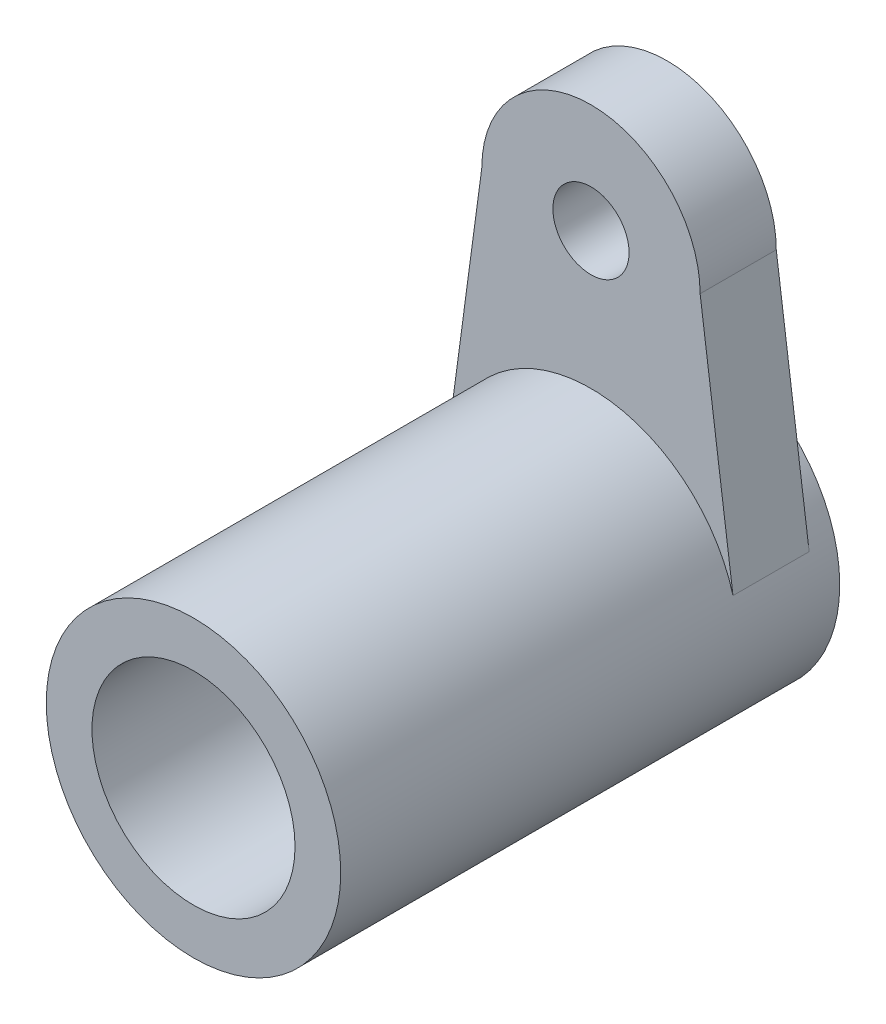
from build123d import *

# Parameters (mm, degrees)
EXTRUDE_1_DEPTH     = 1.5
SKETCH_3_R          = 2.9
EXTRUDE_2_DEPTH     = 3.829
EXTRUDE_START       = 0.5
SKETCH_4_R          = 2.9
EXTRUDE_3_DEPTH     = 0.5
SKETCH_5_R          = 2
CUT_EXTRUDE_1_DEPTH = 3
CUT_EXTRUDE_START   = -0.7
SKETCH_6_R          = 2
CUT_EXTRUDE_2_DEPTH = 0.7
SKETCH_7_R          = 1.1
CUT_EXTRUDE_3_DEPTH = 3.7
SKETCH_8_R          = 0.75
CUT_EXTRUDE_4_DEPTH = 3.7
SKETCH_10_R         = 2.9
SKETCH_10_R_2       = 2
EXTRUDE_4_DEPTH     = 4


with BuildPart() as part:
    # 草图1 → 凸台-拉伸1 (new body)
    with BuildSketch(Plane.XY):
        with BuildLine():
            Line((-2.15, 0), (-2.797439847, -4.825584994))
            ThreePointArc((-2.797439847, -4.825584994), (0, -8.49), (2.797439847, -4.825584994))
            Line((2.797439847, -4.825584994), (2.15, 0))
            ThreePointArc((2.15, 0), (0, 2.15), (-2.15, 0))
        make_face()
    extrude(amount=EXTRUDE_1_DEPTH)

    # 草图3 → 凸台-拉伸2 (add)
    with BuildSketch(Plane.XY.offset(1.5)):
        with Locations((0, -5.59)):
            Circle(SKETCH_3_R)
    extrude(amount=EXTRUDE_2_DEPTH)

    # 草图4 → 凸台-拉伸3 (add)
    with BuildSketch(Plane(origin=(0, 0, 0), x_dir=(-1, 0, 0), z_dir=(0, 0, -1)).offset(EXTRUDE_START)):
        with Locations((0, -5.59)):
            Circle(SKETCH_4_R)
    extrude(amount=-EXTRUDE_3_DEPTH)

    # 草图5 → 切除-拉伸1 (cut)
    with BuildSketch(Plane.XY.offset(5.329)):
        with Locations((0, -5.59)):
            Circle(SKETCH_5_R)
    extrude(amount=-CUT_EXTRUDE_1_DEPTH, mode=Mode.SUBTRACT)

    # 草图6 → 切除-拉伸2 (cut)
    with BuildSketch(Plane(origin=(0, 0, -0.5), x_dir=(-1, 0, 0), z_dir=(0, 0, -1)).offset(CUT_EXTRUDE_START)):
        with Locations((0, -5.59)):
            Circle(SKETCH_6_R)
    extrude(amount=CUT_EXTRUDE_2_DEPTH, mode=Mode.SUBTRACT)

    # 草图7 → 切除-拉伸3 (cut)
    with BuildSketch(Plane(origin=(0, 0, 0.2), x_dir=(-1, 0, 0), z_dir=(0, 0, -1))):
        with Locations((0, -5.59)):
            Circle(SKETCH_7_R)
    extrude(amount=-CUT_EXTRUDE_3_DEPTH, mode=Mode.SUBTRACT)

    # 草图8 → 切除-拉伸4 (cut)
    with BuildSketch(Plane.XY.offset(1.5)):
        Circle(SKETCH_8_R)
    extrude(amount=-CUT_EXTRUDE_4_DEPTH, mode=Mode.SUBTRACT)

    # 草图10 → 凸台-拉伸4 (add)
    with BuildSketch(Plane.XY.offset(5.329)):
        with Locations((0, -5.59)):
            Circle(SKETCH_10_R)
        with Locations((0, -5.59)):
            Circle(SKETCH_10_R_2, mode=Mode.SUBTRACT)
    extrude(amount=EXTRUDE_4_DEPTH)


solid = part.part
